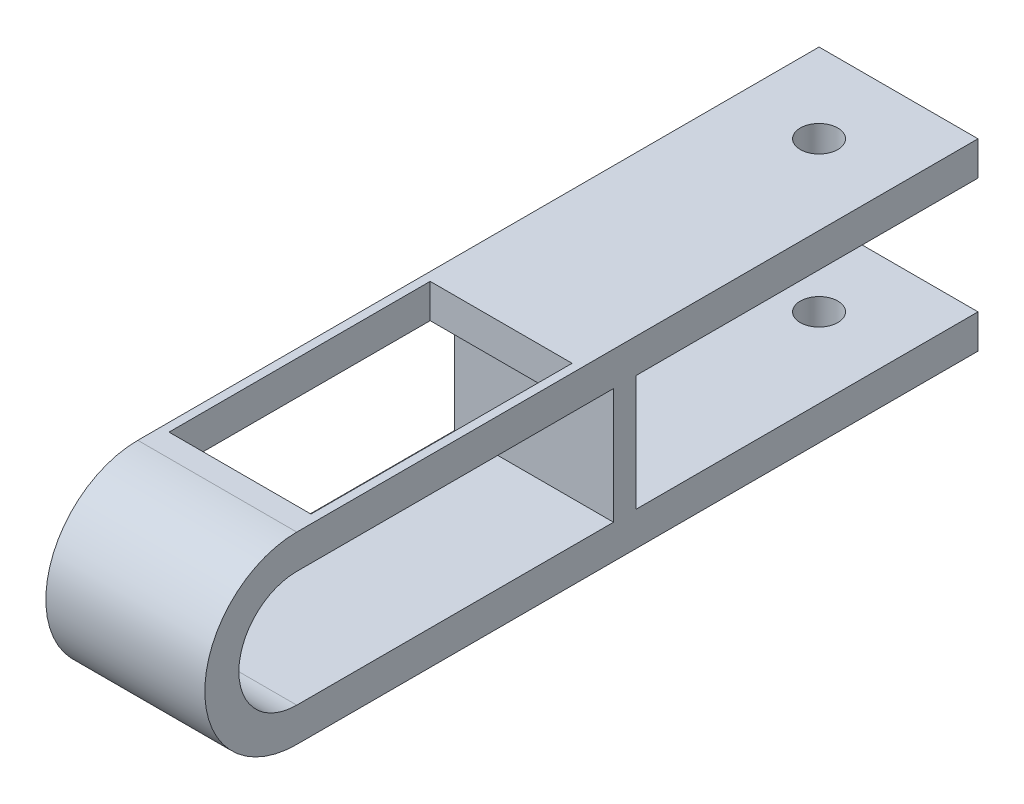
from build123d import *

# Parameters (mm, degrees)
BOSS_EXTRUDE1_DEPTH = 14
SKETCH3_R           = 1.65
CUT_EXTRUDE1_DEPTH  = 40
CUT_EXTRUDE2_DEPTH  = 1.3
SKETCH6_R           = 0.15
CUT_EXTRUDE3_DEPTH  = 0.5
SKETCH8_R           = 0.15
CUT_EXTRUDE4_DEPTH  = 0.5
CUT_EXTRUDE5_REACH  = 73.387
SKETCH9_W           = 12.5
SKETCH9_H           = 23


with BuildPart() as part:
    # Sketch2 → Boss-Extrude1 (new body)
    with BuildSketch(Plane.YZ):
        with BuildLine():
            Line((8.1, 0), (5.1, 0))
            Line((5.1, 0), (5.1, 30.1))
            Line((5.1, 30.1), (-5.1, 30.1))
            Line((-5.1, 30.1), (-5.1, 0))
            Line((-5.1, 0), (-8.1, 0))
            Line((-8.1, 0), (-8.1, 60))
            ThreePointArc((-8.1, 60), (0, 68.1), (8.1, 60))
            Line((8.1, 60), (8.1, 0))
        make_face()
        with BuildLine():
            Line((-5.1, 60), (-5.1, 32.1))
            Line((-5.1, 32.1), (5.1, 32.1))
            Line((5.1, 32.1), (5.1, 60))
            ThreePointArc((5.1, 60), (0, 65.1), (-5.1, 60))
        make_face(mode=Mode.SUBTRACT)
    extrude(amount=BOSS_EXTRUDE1_DEPTH)

    # Sketch3 → Cut-Extrude1 (cut)
    with BuildSketch(Plane.XZ.offset(8.1)):
        with Locations((7, 7)):
            Circle(SKETCH3_R)
    extrude(amount=-CUT_EXTRUDE1_DEPTH, mode=Mode.SUBTRACT)

    # Sketch4 → Cut-Extrude2 (cut)
    with BuildSketch(Plane.XZ.offset(8.1)):
        with BuildLine():
            ThreePointArc((10.6, 53), (7, 56.6), (3.4, 53))
            Line((3.4, 53), (4.65, 38))
            ThreePointArc((4.65, 38), (7, 35.65), (9.35, 38))
            Line((9.35, 38), (10.6, 53))
        make_face()
    extrude(amount=-CUT_EXTRUDE2_DEPTH, mode=Mode.SUBTRACT)

    # Sketch6 → Cut-Extrude3 (cut)
    with BuildSketch(Plane.XZ.offset(6.8)):
        with Locations((7, 38)):
            Circle(SKETCH6_R)
    extrude(amount=-CUT_EXTRUDE3_DEPTH, mode=Mode.SUBTRACT)

    # Sketch8 → Cut-Extrude4 (cut)
    with BuildSketch(Plane.XZ.offset(6.8)):
        with Locations((7, 53)):
            Circle(SKETCH8_R)
    extrude(amount=-CUT_EXTRUDE4_DEPTH, mode=Mode.SUBTRACT)

    # Sketch9 → Cut-Extrude5 (cut, up to next)
    with BuildSketch(Plane(origin=(0, 8.1, 0), x_dir=(-1, 0, 0), z_dir=(0, 1, 0)), mode=Mode.PRIVATE) as cut_extrude5_sk1:
        with Locations((-7, 46.5)):
            Rectangle(SKETCH9_W, SKETCH9_H)
    cut_extrude5_tool1 = extrude(cut_extrude5_sk1.sketch, amount=-CUT_EXTRUDE5_REACH, mode=Mode.PRIVATE) & part.part
    add(cut_extrude5_tool1.solids().sort_by_distance((7, 8.1, 46.5))[0], mode=Mode.SUBTRACT)


solid = part.part
